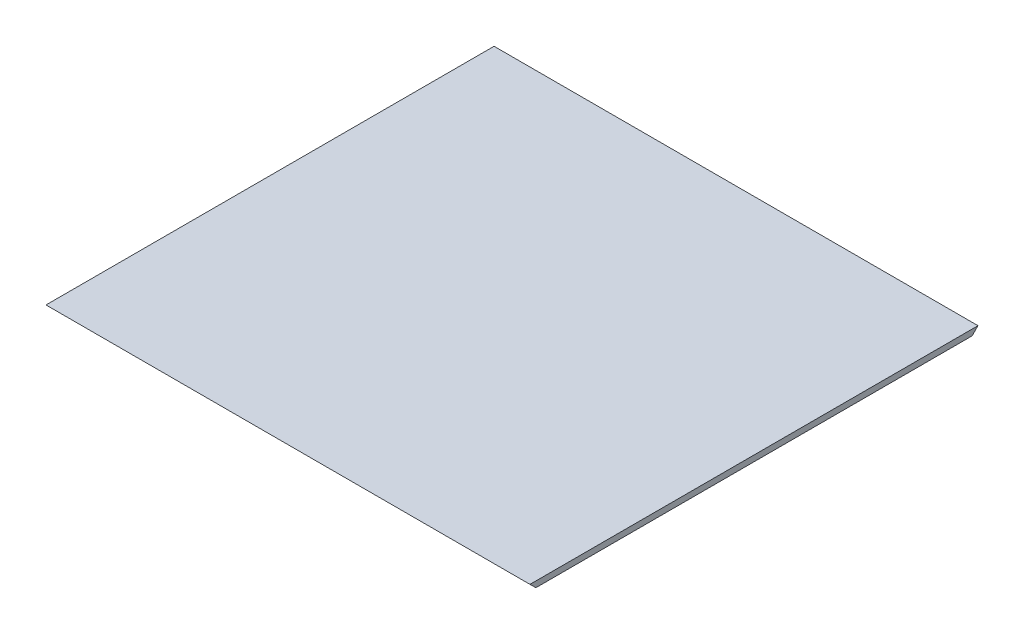
from build123d import *

# Parameters (mm, degrees)
SKETCH1_W           = 260.35
SKETCH1_H           = 241.046
BOSS_EXTRUDE1_DEPTH = 1.5875
CUT_EXTRUDE2_DEPTH  = 287.897954306


with BuildPart() as part:
    # Sketch1 → Boss-Extrude1 (new, symmetric)
    with BuildSketch(Plane(origin=(0, 0, 0), x_dir=(1, 0, 0), z_dir=(0, 1, 0))):
        Rectangle(SKETCH1_W, SKETCH1_H)
    extrude(amount=BOSS_EXTRUDE1_DEPTH, both=True)

    # Sketch3 → Cut-Extrude2 (cut, through all)
    with BuildSketch(Plane.ZY.offset(130.175)):
        Polygon((120.523, 1.5875), (117.316753604, -1.5875), (181.759591699, -66.664544845), (184.965838095, -63.489544845), align=None)
        Polygon((-120.523, 1.5875), (-115.936493069, -2.999006931), (-117.69089956, -4.753413422), (-122.277406491, -0.166906491), align=None)
    extrude(amount=-CUT_EXTRUDE2_DEPTH, mode=Mode.SUBTRACT)


solid = part.part
